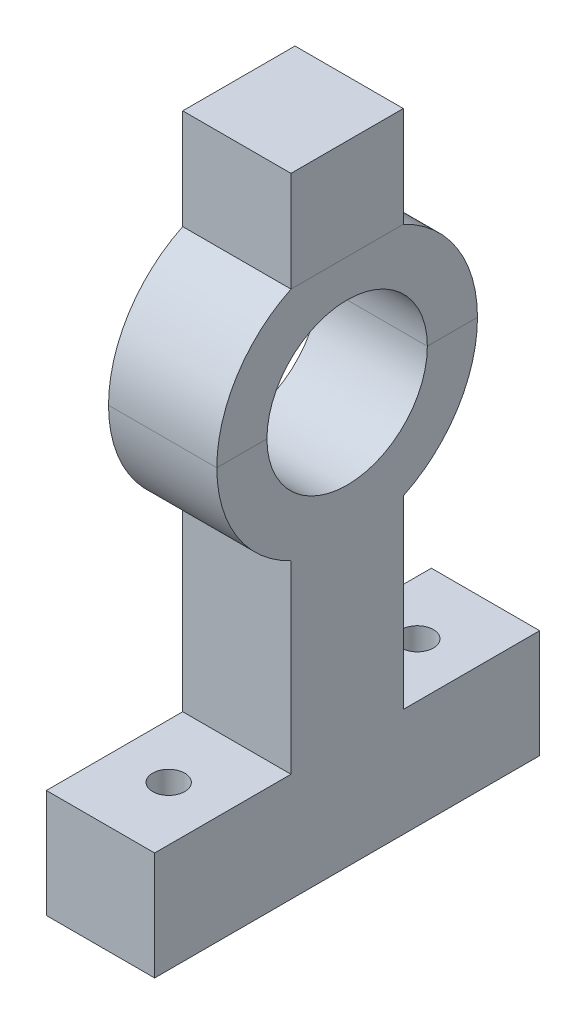
from build123d import *

# Parameters (mm, degrees)
SKETCH2_W              = 34
SKETCH2_H              = 27
SKETCH2_W_2            = 28
SKETCH2_H_2            = 73.1
BOSS_EXTRUDE1_DEPTH    = 27
CUT_EXTRUDE1_DEPTH     = 27
CUT_EXTRUDE2_START     = -36.55
CUT_EXTRUDE2_OUTLINE_R = 4
CUT_EXTRUDE2_DEPTH     = 27
BOSS_EXTRUDE3_DEPTH    = 27
SKETCH2_4_W            = 28
SKETCH2_4_H            = 25
BOSS_EXTRUDE4_DEPTH    = 27


# Read off the part's stored shape, not the designer's step: Cut-Extrude2
with BuildPart() as part:
    # Sketch2 → Boss-Extrude1 (new body)
    with BuildSketch(Plane(origin=(0, 0, 0), x_dir=(0, 0, -1), z_dir=(1, 0, 0))):
        with Locations((-31, -23.05)):
            Rectangle(SKETCH2_W, SKETCH2_H)
        Rectangle(SKETCH2_W_2, SKETCH2_H_2)
        with Locations((31, -23.05)):
            Rectangle(SKETCH2_W, SKETCH2_H)
        with BuildLine():
            ThreePointArc((-32.5, 65.880018752), (-27.488634015, 48.541477868), (-14, 36.55))
            Line((-14, 36.55), (14, 36.55))
            ThreePointArc((14, 36.55), (27.488634015, 48.541477868), (32.5, 65.880018752))
            Line((32.5, 65.880018752), (20, 65.880018752))
            ThreePointArc((20, 65.880018752), (0, 45.880018752), (-20, 65.880018752))
            Line((-20, 65.880018752), (-32.5, 65.880018752))
        make_face()
    extrude(amount=BOSS_EXTRUDE1_DEPTH)

    # Sketch3 → Cut-Extrude1 (cut)
    with BuildSketch(Plane(origin=(0, -9.55, 0), x_dir=(1, 0, 0), z_dir=(0, 1, 0))):
        with BuildLine():
            ThreePointArc((15.987528574, -27.86755661), (10.36755661, -28.512471426), (11.012471426, -34.13244339))
            Line((11.012471426, -34.13244339), (15.987528574, -27.86755661))
        make_face()
        with BuildLine():
            Line((15.987528574, -27.86755661), (11.012471426, -34.13244339))
            ThreePointArc((11.012471426, -34.13244339), (15.239236284, -34.602090664), (17.5, -31))
            ThreePointArc((17.5, -31), (17.102090664, -29.260763716), (15.987528574, -27.86755661))
        make_face()
    extrude(amount=-CUT_EXTRUDE1_DEPTH, mode=Mode.SUBTRACT)

    # Cut-Extrude2 outline → Cut-Extrude2 (cut)
    with BuildSketch(Plane(origin=(0, 0, 0), x_dir=(1, 0, 0), z_dir=(0, 1, 0)).offset(CUT_EXTRUDE2_START)):
        with Locations((13.5, 31)):
            Circle(CUT_EXTRUDE2_OUTLINE_R)
    extrude(amount=CUT_EXTRUDE2_DEPTH, mode=Mode.SUBTRACT)


with BuildPart() as body_2:
    # Sketch2<3> → Boss-Extrude3 (new body)
    with BuildSketch(Plane(origin=(0, 0, 0), x_dir=(0, 0, -1), z_dir=(1, 0, 0))):
        with BuildLine():
            ThreePointArc((-14, 95.210037504), (-27.488634015, 83.218559637), (-32.5, 65.880018752))
            Line((-32.5, 65.880018752), (-20, 65.880018752))
            ThreePointArc((-20, 65.880018752), (0, 85.880018752), (20, 65.880018752))
            Line((20, 65.880018752), (32.5, 65.880018752))
            ThreePointArc((32.5, 65.880018752), (27.488634015, 83.218559637), (14, 95.210037504))
            Line((14, 95.210037504), (-14, 95.210037504))
        make_face()
    extrude(amount=BOSS_EXTRUDE3_DEPTH)


with BuildPart() as body_3:
    # Sketch2<4> → Boss-Extrude4 (new body)
    with BuildSketch(Plane(origin=(0, 0, 0), x_dir=(0, 0, -1), z_dir=(1, 0, 0))):
        with Locations((0, 107.710037504)):
            Rectangle(SKETCH2_4_W, SKETCH2_4_H)
    extrude(amount=BOSS_EXTRUDE4_DEPTH)


solid = Compound([part.part, body_2.part, body_3.part])
